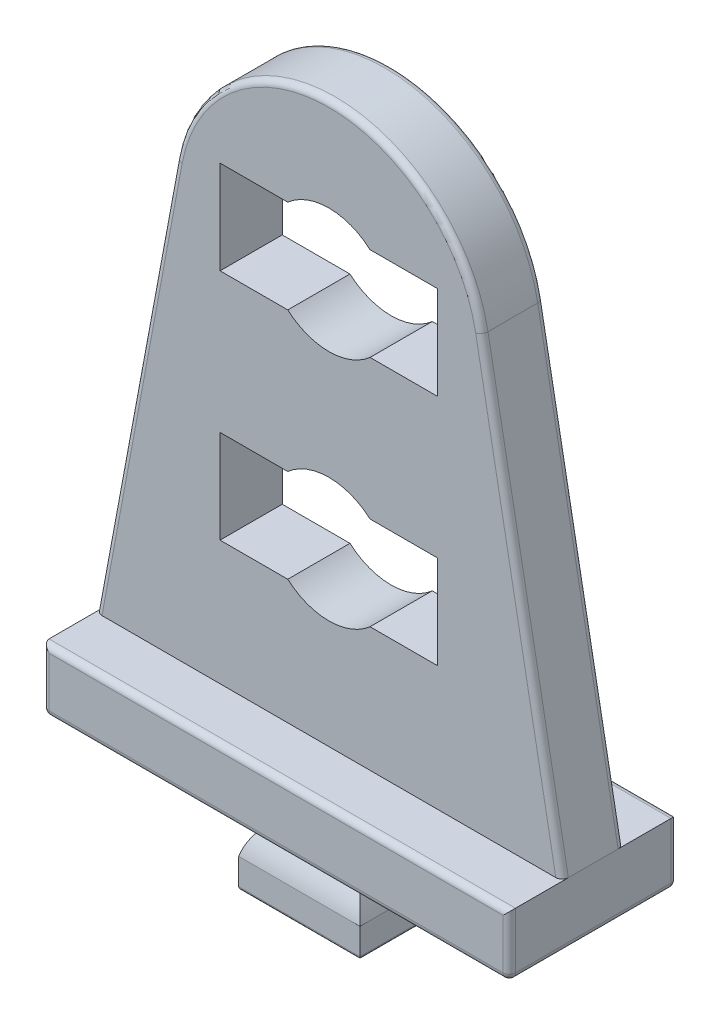
from build123d import *

# Parameters (mm, degrees)
EXTRUDE_1_DEPTH          = 2.7
EXTRUDE_1_DEPTH_BACK     = 2.7
EXTRUDE_2_DEPTH          = 1
EXTRUDE_2_DEPTH_BACK     = 1
CUT_EXTRUDE_1_DEPTH      = 22.678099548
PATTERN_LINEAR_1_COUNT   = 2
PATTERN_LINEAR_1_PITCH   = 7.5
EXTRUDE_3_DEPTH          = 2
EXTRUDE_3_DEPTH_BACK     = 2
CUT_EXTRUDE_2_DEPTH      = 2
CUT_EXTRUDE_2_DEPTH_BACK = 2
FILLET_1_R               = 0.1
FILLET_4_R               = 0.2
FILLET_5_R               = 0.2
FILLET_7_R               = 0.2


with BuildPart() as part:
    # 草图1 → 凸台-拉伸1 (new, two sides: drawn at the far end of the back side and taken through both)
    with BuildSketch(Plane.XY.offset(-EXTRUDE_1_DEPTH_BACK)):
        Polygon((0, 0), (7.5, 0), (7.5, 2), (-7.5, 2), (-7.5, 0), align=None)
    extrude(amount=EXTRUDE_1_DEPTH + EXTRUDE_1_DEPTH_BACK)

    # 草图2 → 凸台-拉伸2 (add, two sides: drawn at the far end of the back side and taken through both)
    with BuildSketch(Plane.XY.offset(-EXTRUDE_2_DEPTH_BACK)):
        with BuildLine():
            Line((-7.5, 2), (-4.91592968, 15.913036354))
            ThreePointArc((-4.91592968, 15.913036354), (0, 20), (4.91592968, 15.913036354))
            Line((4.91592968, 15.913036354), (7.5, 2))
            Line((7.5, 2), (-7.5, 2))
        make_face()
    extrude(amount=EXTRUDE_2_DEPTH + EXTRUDE_2_DEPTH_BACK)

    # 草图3 → 切除-拉伸1 (cut, through all)
    with BuildSketch(Plane.XY.offset(1)):
        with BuildLine():
            Line((3.5, 6), (3.5, 9))
            Line((3.5, 9), (1.322875656, 9))
            ThreePointArc((1.322875656, 9), (0, 9.5), (-1.322875656, 9))
            Line((-1.322875656, 9), (-3.5, 9))
            Line((-3.5, 9), (-3.5, 6))
            Line((-3.5, 6), (-1.322875656, 6))
            ThreePointArc((-1.322875656, 6), (0, 5.5), (1.322875656, 6))
            Line((1.322875656, 6), (3.5, 6))
        make_face()
    cut_extrude_1 = extrude(amount=-CUT_EXTRUDE_1_DEPTH, mode=Mode.SUBTRACT)

    # 阵列(线性)1: 切除-拉伸1 ×2
    with Locations(*[(0, i * PATTERN_LINEAR_1_PITCH, 0) for i in range(1, PATTERN_LINEAR_1_COUNT)]):
        add(cut_extrude_1, mode=Mode.SUBTRACT)

    # 草图4 → 凸台-拉伸3 (add, two sides: drawn at the far end of the back side and taken through both)
    with BuildSketch(Plane.XY.offset(-EXTRUDE_3_DEPTH_BACK)):
        with BuildLine():
            Line((1.5, 0), (-1.5, 0))
            Line((-1.5, 0), (-1.5, -0.677124344))
            ThreePointArc((-1.5, -0.677124344), (-1.780042303, -1.088161527), (-1.95, -1.555590279))
            Line((-1.95, -1.555590279), (-1.95, -2.5))
            Line((-1.95, -2.5), (1.95, -2.5))
            Line((1.95, -2.5), (1.95, -1.555590279))
            ThreePointArc((1.95, -1.555590279), (1.780042303, -1.088161527), (1.5, -0.677124344))
            Line((1.5, -0.677124344), (1.5, 0))
        make_face()
    extrude(amount=EXTRUDE_3_DEPTH + EXTRUDE_3_DEPTH_BACK)

    # 草图5 → 切除-拉伸2 (cut, two sides: drawn at the far end of the back side and taken through both)
    with BuildSketch(Plane(origin=(0, 0, 0), x_dir=(0, 0, -1), z_dir=(1, 0, 0)).offset(-CUT_EXTRUDE_2_DEPTH_BACK)):
        with BuildLine():
            Line((1.5, 0), (1.5, -0.677124344))
            ThreePointArc((1.5, -0.677124344), (1.780042303, -1.088161527), (1.95, -1.555590279))
            Line((1.95, -1.555590279), (1.95, -2.5))
            Line((1.95, -2.5), (2, -2.5))
            Line((2, -2.5), (2, 0))
            Line((2, 0), (1.5, 0))
        make_face()
        with BuildLine():
            Line((-2, 0), (-1.5, 0))
            Line((-1.5, 0), (-1.5, -0.677124344))
            ThreePointArc((-1.5, -0.677124344), (-1.780042303, -1.088161527), (-1.95, -1.555590279))
            Line((-1.95, -1.555590279), (-1.95, -2.5))
            Line((-1.95, -2.5), (-2, -2.5))
            Line((-2, -2.5), (-2, 0))
        make_face()
    extrude(amount=CUT_EXTRUDE_2_DEPTH + CUT_EXTRUDE_2_DEPTH_BACK, mode=Mode.SUBTRACT)

    # 圆角1
    fillet_1_edges = [part.edges().sort_by_distance(p)[0] for p in [
        (-1.95, -2.5, 0),
        (1.95, -2.5, 0),
        (0, -2.5, -1.95),
        (0, -2.5, 1.95),
    ]]
    fillet(fillet_1_edges, radius=FILLET_1_R)

    # 圆角4
    fillet_4_edges = [part.edges().sort_by_distance(p)[0] for p in [
        (-7.5, 1, 2.7),
        (0, 2, 2.7),
        (7.5, 1, 2.7),
        (0, 0, 2.7),
        (7.5, 1, -2.7),
        (0, 2, -2.7),
        (-7.5, 1, -2.7),
        (0, 0, -2.7),
    ]]
    fillet(fillet_4_edges, radius=FILLET_4_R)

    # 圆角5
    # the kernel refuses this fillet: 0.2 mm, written as the material it takes off along each edge
    with BuildSketch(Plane(origin=(7.3, 0.2, 2.5), x_dir=(1, 0, 0), z_dir=(0, -1, 0))) as fillet_5_piece_1_section:
        Polygon((0, 0), (FILLET_5_R, 0), (FILLET_5_R, FILLET_5_R), (0, FILLET_5_R), align=None)
    fillet_5_piece_1 = extrude(amount=FILLET_5_R, mode=Mode.PRIVATE)
    fillet_5_piece_1 = fillet_5_piece_1 - Plane(origin=(7.3, 0.2, 2.5), x_dir=(-0.7071067811865475, 0, -0.7071067811865475), z_dir=(0, -1, 0)) * Sphere(FILLET_5_R, mode=Mode.PRIVATE)
    add(fillet_5_piece_1, mode=Mode.SUBTRACT)
    with BuildSketch(Plane(origin=(-7.3, 0.2, 2.5), x_dir=(-1, 0, 0), z_dir=(0, -1, 0))) as fillet_5_piece_2_section:
        Polygon((0, 0), (FILLET_5_R, 0), (FILLET_5_R, -FILLET_5_R), (0, -FILLET_5_R), align=None)
    fillet_5_piece_2 = extrude(amount=FILLET_5_R, mode=Mode.PRIVATE)
    fillet_5_piece_2 = fillet_5_piece_2 - Plane(origin=(-7.3, 0.2, 2.5), x_dir=(0.7071067811865475, 1.2560739669470211e-15, -0.7071067811865475), z_dir=(0, -1, 0)) * Sphere(FILLET_5_R, mode=Mode.PRIVATE)
    add(fillet_5_piece_2, mode=Mode.SUBTRACT)
    with BuildSketch(Plane(origin=(-7.3, 0.2, -2.5), x_dir=(-1, 0, 0), z_dir=(0, -1, 0))) as fillet_5_piece_3_section:
        Polygon((0, 0), (FILLET_5_R, 0), (FILLET_5_R, FILLET_5_R), (0, FILLET_5_R), align=None)
    fillet_5_piece_3 = extrude(amount=FILLET_5_R, mode=Mode.PRIVATE)
    fillet_5_piece_3 = fillet_5_piece_3 - Plane(origin=(-7.3, 0.2, -2.5), x_dir=(0.7071067811865475, 1.2560739669470211e-15, 0.7071067811865475), z_dir=(0, -1, 0)) * Sphere(FILLET_5_R, mode=Mode.PRIVATE)
    add(fillet_5_piece_3, mode=Mode.SUBTRACT)
    with BuildSketch(Plane(origin=(7.3, 0.2, -2.5), x_dir=(1, 0, 0), z_dir=(0, -1, 0))) as fillet_5_piece_4_section:
        Polygon((0, 0), (FILLET_5_R, 0), (FILLET_5_R, -FILLET_5_R), (0, -FILLET_5_R), align=None)
    fillet_5_piece_4 = extrude(amount=FILLET_5_R, mode=Mode.PRIVATE)
    fillet_5_piece_4 = fillet_5_piece_4 - Plane(origin=(7.3, 0.2, -2.5), x_dir=(-0.7071067811865475, 0, 0.7071067811865475), z_dir=(0, -1, 0)) * Sphere(FILLET_5_R, mode=Mode.PRIVATE)
    add(fillet_5_piece_4, mode=Mode.SUBTRACT)
    with BuildSketch(Plane(origin=(-7.5, 0, 2.5), x_dir=(1, 0, 0), z_dir=(0, 0, -1)), Plane(origin=(7.5, 0, -2.5), x_dir=(-1, 0, 0), z_dir=(0, 0, 1))) as fillet_5_piece_5:
        with BuildLine():
            CenterArc((FILLET_5_R, -FILLET_5_R), FILLET_5_R, 90, 90)
            Line((0, -FILLET_5_R), (0, 0))
            Line((0, 0), (FILLET_5_R, 0))
        make_face()
    extrude(amount=5, mode=Mode.SUBTRACT)

    # 圆角7
    fillet_7_edges = [part.edges().sort_by_distance(p)[0] for p in [
        (6.20796484, 8.956518177, 1),
        (0, 20, 1),
        (-6.20796484, 8.956518177, 1),
        (-6.20796484, 8.956518177, -1),
        (0, 20, -1),
        (6.20796484, 8.956518177, -1),
    ]]
    fillet(fillet_7_edges, radius=FILLET_7_R)


solid = part.part
